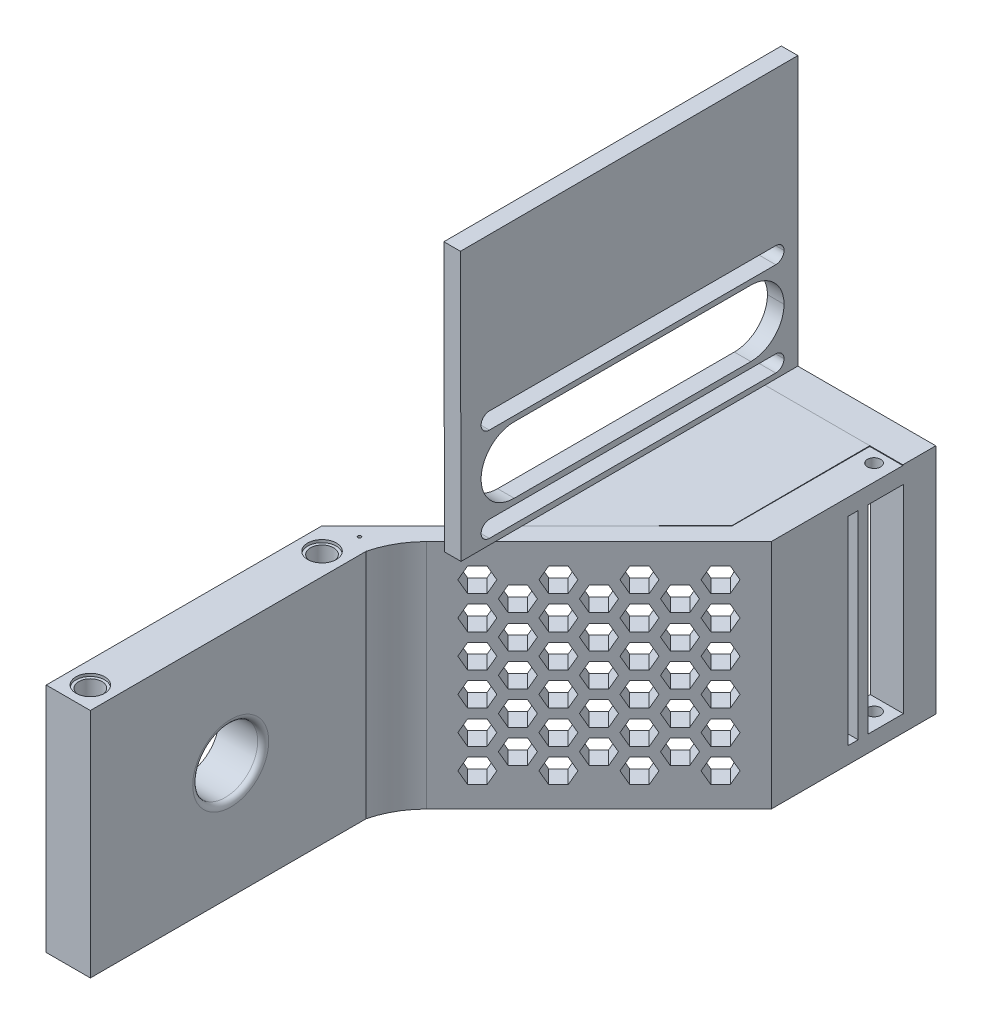
from build123d import *

# Parameters (mm, degrees)
SKETCH1_W            = 25
SKETCH1_H            = 50
SKETCH1_R            = 3.4
BOSS_EXTRUDE1_DEPTH  = 3
SKETCH2_W            = 50
SKETCH2_H            = 3
BOSS_EXTRUDE2_DEPTH  = 8
SKETCH3_W            = 8
SKETCH3_H            = 50
BOSS_EXTRUDE3_DEPTH  = 42
SKETCH4_R            = 2.65
CUT_EXTRUDE1_DEPTH   = 0.5
SKETCH5_R            = 5.888972746
CUT_EXTRUDE2_DEPTH   = 9
FILLET2_R            = 1
SKETCH6_R            = 12.6
BOSS_EXTRUDE4_DEPTH  = 2
FILLET4_R            = 1
SKETCH8_R            = 1.589780168
SKETCH8_R_2          = 1.777428262
CUT_EXTRUDE3_DEPTH   = 10
SKETCH9_W            = 49.021678163
SKETCH9_H            = 20.976854622
CUT_EXTRUDE4_DEPTH   = 68.79439129
SKETCH11_R           = 2.1
CUT_EXTRUDE5_DEPTH   = 59.480168703
SKETCH14_R           = 2.6
CUT_EXTRUDE6_DEPTH   = 0.5
BOSS_EXTRUDE5_DEPTH  = 42
FILLET5_R            = 15
BOSS_EXTRUDE6_DEPTH  = 42
SKETCH17_W           = 55.081474993
SKETCH17_H           = 48.753311723
BOSS_EXTRUDE7_DEPTH  = 3
BOSS_EXTRUDE8_DEPTH  = 2
FILL_START           = -39.593416363
FILL_PATTERN1_DEPTH  = 4.479865946
SKETCH27_W           = 7.5
SKETCH27_H           = 36
CUT_EXTRUDE11_DEPTH  = 117.155303663
SKETCH28_R           = 1.2
CUT_EXTRUDE12_DEPTH  = 113.83644218
SKETCH29_W           = 6
SKETCH29_H           = 42
BOSS_EXTRUDE11_DEPTH = 5.87
CHAMFER1_SIZE        = 4
SKETCH30_R           = 0.3
CUT_EXTRUDE13_DEPTH  = 118.999595961
SKETCH31_W           = 1.8
SKETCH31_H           = 36
CUT_EXTRUDE14_DEPTH  = 10
BOSS_EXTRUDE13_REACH = 132.206
SKETCH33_W           = 28
SKETCH33_H           = 1.999994694
BOSS_EXTRUDE14_REACH = 126.717
SKETCH34_W           = 3
SKETCH34_H           = 48.753311723
SKETCH35_W           = 54.914706507
SKETCH35_H           = 12
CUT_EXTRUDE15_DEPTH  = 4
FILLET6_R            = 6
FILLET7_R            = 6
SKETCH36_W           = 54.914706507
SKETCH36_H           = 3
CUT_EXTRUDE16_DEPTH  = 4
FILLET8_R            = 1.5


# Read off the part's stored shape, not the designer's step: Fill Pattern1
# Some blends are built 0.0001 mm under size
with BuildPart() as part:
    # Sketch1 → Boss-Extrude1 (new body)
    with BuildSketch(Plane(origin=(0, 0, 0), x_dir=(1, 0, 0), z_dir=(0, 1, 0))):
        with Locations((2.276951673, 11.384758364)):
            Rectangle(SKETCH1_W, SKETCH1_H)
        with Locations(Location((1.276951673, 11.384758364, 0), (0, 0, 270))):
            Circle(SKETCH1_R, mode=Mode.SUBTRACT)
    extrude(amount=BOSS_EXTRUDE1_DEPTH)

    # Sketch2 → Boss-Extrude2 (add)
    with BuildSketch(Plane.ZY.offset(10.223048327)):
        with Locations((-11.384758364, 1.5)):
            Rectangle(SKETCH2_W, SKETCH2_H)
    extrude(amount=BOSS_EXTRUDE2_DEPTH)

    # Sketch3 → Boss-Extrude3 (add)
    with BuildSketch(Plane.XZ):
        with Locations((-14.223048327, -11.384758364)):
            Rectangle(SKETCH3_W, SKETCH3_H)
    extrude(amount=BOSS_EXTRUDE3_DEPTH)

    # Sketch4 → Cut-Extrude1 (cut)
    with BuildSketch(Plane(origin=(0, 3, 0), x_dir=(1, 0, 0), z_dir=(0, 1, 0))):
        with Locations(Location((-14.223048327, 32.384758364, 0), (0, 0, 270))):
            Circle(SKETCH4_R)
        with Locations(Location((-14.223048327, -9.615241636, 0), (0, 0, 270))):
            Circle(SKETCH4_R)
    cut_extrude1 = extrude(amount=-CUT_EXTRUDE1_DEPTH, mode=Mode.SUBTRACT)

    # Mirror1: Cut-Extrude1 across plane
    add(cut_extrude1.mirror(Plane.ZX.offset(-19.5)), mode=Mode.SUBTRACT)

    # Sketch5 → Cut-Extrude2 (cut)
    with BuildSketch(Plane.ZY.offset(18.223048327)):
        with Locations((-11.836279124, -21)):
            Circle(SKETCH5_R)
    extrude(amount=-CUT_EXTRUDE2_DEPTH, mode=Mode.SUBTRACT)

    # Fillet2
    fillet2_edges = [part.edges().sort_by_distance(p)[0] for p in [
        (-10.223048327, -21, -17.72525187),
    ]]
    fillet(fillet2_edges, radius=FILLET2_R)

    # Mirror2: Cut-Extrude1 across plane
    add(cut_extrude1.mirror(Plane.ZY.offset(1.723048327)), mode=Mode.SUBTRACT)

    # Sketch6 → Boss-Extrude4 (add)
    with BuildSketch(Plane(origin=(0, 3, 0), x_dir=(1, 0, 0), z_dir=(0, 1, 0))):
        with BuildLine():
            Line((14.776951673, 5.825082115), (14.776951673, 16.944434614))
            ThreePointArc((14.776951673, 16.944434614), (-13.323048327, 11.384758364), (14.776951673, 5.825082115))
        make_face()
        with Locations(Location((1.276951673, 11.384758364, 0), (0, 0, 270))):
            Circle(SKETCH6_R, mode=Mode.SUBTRACT)
    extrude(amount=BOSS_EXTRUDE4_DEPTH)

    # Fillet4
    # the kernel refuses this fillet: 1 mm, written as the material it takes off along each edge
    with BuildSketch(Plane(origin=(14.776951673, 5, -3.325082115), x_dir=(0, -1, 0), z_dir=(0, 0, -1))) as fillet4_piece_1:
        with BuildLine():
            CenterArc((FILLET4_R, FILLET4_R), FILLET4_R, 180, 90)
            Line((0, FILLET4_R), (0, 0))
            Line((0, 0), (FILLET4_R, 0))
        make_face()
    extrude(amount=16.119352499, mode=Mode.SUBTRACT)

    # Sketch8 → Cut-Extrude3 (cut)
    with BuildSketch(Plane(origin=(0, 3, 0), x_dir=(1, 0, 0), z_dir=(0, 1, 0))):
        with Locations(Location((1.276951673, 19.884758364, 0), (0, 0, 270))):
            Circle(SKETCH8_R)
        with Locations(Location((1.276951673, 2.884758364, 0), (0, 0, 270))):
            Circle(SKETCH8_R_2)
    extrude(amount=-CUT_EXTRUDE3_DEPTH, mode=Mode.SUBTRACT)

    # Sketch9 → Cut-Extrude4 (cut, through all)
    with BuildSketch(Plane.XY.offset(13.615241636)):
        with Locations((-9.733887409, 10.488427311)):
            Rectangle(SKETCH9_W, SKETCH9_H)
    extrude(amount=-CUT_EXTRUDE4_DEPTH, mode=Mode.SUBTRACT)

    # Sketch11 → Cut-Extrude5 (cut, through all)
    with BuildSketch(Plane(origin=(0, 0, 0), x_dir=(1, 0, 0), z_dir=(0, 1, 0))):
        with Locations(Location((-14.223048327, 32.384758364, 0), (0, 0, 270))):
            Circle(SKETCH11_R)
    cut_extrude5 = extrude(amount=-CUT_EXTRUDE5_DEPTH, mode=Mode.SUBTRACT)

    # Mirror3: Cut-Extrude5 across plane
    add(cut_extrude5.mirror(Plane.XY.offset(-11.384758364)), mode=Mode.SUBTRACT)

    # Sketch14 → Cut-Extrude6 (cut)
    with BuildSketch(Plane(origin=(0, 0, 0), x_dir=(1, 0, 0), z_dir=(0, 1, 0))):
        with Locations(Location((-14.223048327, -9.615241636, 0), (0, 0, 270))):
            Circle(SKETCH14_R)
    cut_extrude6 = extrude(amount=-CUT_EXTRUDE6_DEPTH, mode=Mode.SUBTRACT)

    # Mirror4: Cut-Extrude6 across plane
    add(cut_extrude6.mirror(Plane.XY.offset(-11.384758364)), mode=Mode.SUBTRACT)

    # Sketch15 → Boss-Extrude5 (add)
    with BuildSketch(Plane(origin=(0, 0, 0), x_dir=(1, 0, 0), z_dir=(0, 1, 0))):
        Polygon((-18.223048327, 36.384758364), (24.976951673, 79.584758364), (24.976951673, 74.635010896), (-13.273300859, 36.384758364), align=None)
    extrude(amount=-BOSS_EXTRUDE5_DEPTH)

    # Fillet5
    # the kernel refuses this fillet: 15 mm, written as the material it adds along each edge
    with BuildSketch(Plane(origin=(-13.273300859, 0, -36.384758364), x_dir=(1, 0, 0), z_dir=(0, -1, 0))) as fillet5_piece_1:
        with BuildLine():
            CenterArc((17.611399837, 3.601803599), FILLET5_R, 193.893637127, 31.106362873)
            Line((7.004798119, -7.004798119), (0, 0))
            Line((0, 0), (3.050252532, 0))
        make_face()
    extrude(amount=42)

    # Sketch16 → Boss-Extrude6 (add)
    with BuildSketch(Plane(origin=(0, 0, 0), x_dir=(1, 0, 0), z_dir=(0, 1, 0))):
        Polygon((18.976951673, 73.584758364), (18.976951673, 98.584758364), (24.976951673, 98.584758364), (24.976951673, 79.584758364), align=None)
    extrude(amount=-BOSS_EXTRUDE6_DEPTH)



with BuildPart() as body_2:
    # Sketch17 → Boss-Extrude7 (new body)
    with BuildSketch(Plane(origin=(-0.023048327, -88.270826713, 236.630045038), x_dir=(0, 0.002303401717977271, -0.999997347166744), z_dir=(1, 0, 0))):
        with Locations((307.762919346, 112.002250776)):
            Rectangle(SKETCH17_W, SKETCH17_H)
    extrude(amount=-BOSS_EXTRUDE7_DEPTH)


with BuildPart() as part_1:
    add(part.part)

    add(body_2.part)  # Boss-Extrude8 merges body 2
    # Sketch18 → Boss-Extrude8 (add)
    with BuildSketch(Plane(origin=(0, -0.099943314, -0.00023021), x_dir=(1, 0, 0), z_dir=(0, -0.9999973471667442, -0.0023034017179773937))):
        Polygon((-3.023048327, -98.470916371), (-3.023048327, -51.487878646), (18.976951673, -73.487820284), (18.976951673, -98.487753963), (-3.023048327, -98.487753963), align=None)
    extrude(amount=BOSS_EXTRUDE8_DEPTH)

    # Fill Pattern1 outline → Fill Pattern1 (cut)
    with BuildSketch(Plane(origin=(0, 0, 0), x_dir=(0.7071067811865457, 0, -0.7071067811865495), z_dir=(0.7071067811865493, 0, 0.7071067811865458)).offset(FILL_START)):
        Polygon((30.253964255, -6), (31.503964255, -8.165063509), (34.003964255, -8.165063509), (35.253964255, -6), (34.003964255, -3.834936491), (31.503964255, -3.834936491), align=None)
        Polygon((45.842421523, -33), (47.092421523, -35.165063509), (49.592421523, -35.165063509), (50.842421523, -33), (49.592421523, -30.834936491), (47.092421523, -30.834936491), align=None)
        Polygon((40.6462691, -24), (41.8962691, -26.165063509), (44.3962691, -26.165063509), (45.6462691, -24), (44.3962691, -21.834936491), (41.8962691, -21.834936491), align=None)
        Polygon((35.450116678, -15), (36.700116678, -17.165063509), (39.200116678, -17.165063509), (40.450116678, -15), (39.200116678, -12.834936491), (36.700116678, -12.834936491), align=None)
        Polygon((52.288573946, -8.165063509), (54.788573946, -8.165063509), (56.038573946, -6), (54.788573946, -3.834936491), (52.288573946, -3.834936491), (51.038573946, -6), align=None)
        Polygon((41.8962691, -8.165063509), (44.3962691, -8.165063509), (45.6462691, -6), (44.3962691, -3.834936491), (41.8962691, -3.834936491), (40.6462691, -6), align=None)
        Polygon((62.680878791, -8.165063509), (65.180878791, -8.165063509), (66.430878791, -6), (65.180878791, -3.834936491), (62.680878791, -3.834936491), (61.430878791, -6), align=None)
        Polygon((30.253964255, -24), (31.503964255, -26.165063509), (34.003964255, -26.165063509), (35.253964255, -24), (34.003964255, -21.834936491), (31.503964255, -21.834936491), align=None)
        Polygon((35.450116678, -33), (36.700116678, -35.165063509), (39.200116678, -35.165063509), (40.450116678, -33), (39.200116678, -30.834936491), (36.700116678, -30.834936491), align=None)
        Polygon((62.680878791, -26.165063509), (65.180878791, -26.165063509), (66.430878791, -24), (65.180878791, -21.834936491), (62.680878791, -21.834936491), (61.430878791, -24), align=None)
        Polygon((52.288573946, -26.165063509), (54.788573946, -26.165063509), (56.038573946, -24), (54.788573946, -21.834936491), (52.288573946, -21.834936491), (51.038573946, -24), align=None)
        Polygon((57.484726369, -35.165063509), (59.984726369, -35.165063509), (61.234726369, -33), (59.984726369, -30.834936491), (57.484726369, -30.834936491), (56.234726369, -33), align=None)
        Polygon((49.592421523, -17.165063509), (50.842421523, -15), (49.592421523, -12.834936491), (47.092421523, -12.834936491), (45.842421523, -15), (47.092421523, -17.165063509), align=None)
        Polygon((35.450116678, -27), (36.700116678, -29.165063509), (39.200116678, -29.165063509), (40.450116678, -27), (39.200116678, -24.834936491), (36.700116678, -24.834936491), align=None)
        Polygon((30.253964255, -18), (31.503964255, -20.165063509), (34.003964255, -20.165063509), (35.253964255, -18), (34.003964255, -15.834936491), (31.503964255, -15.834936491), align=None)
        Polygon((40.6462691, -36), (41.8962691, -38.165063509), (44.3962691, -38.165063509), (45.6462691, -36), (44.3962691, -33.834936491), (41.8962691, -33.834936491), align=None)
        Polygon((57.484726369, -29.165063509), (59.984726369, -29.165063509), (61.234726369, -27), (59.984726369, -24.834936491), (57.484726369, -24.834936491), (56.234726369, -27), align=None)
        Polygon((47.092421523, -29.165063509), (49.592421523, -29.165063509), (50.842421523, -27), (49.592421523, -24.834936491), (47.092421523, -24.834936491), (45.842421523, -27), align=None)
        Polygon((34.003964255, -38.165063509), (35.253964255, -36), (34.003964255, -33.834936491), (31.503964255, -33.834936491), (30.253964255, -36), (31.503964255, -38.165063509), align=None)
        Polygon((49.592421523, -11.165063509), (50.842421523, -9), (49.592421523, -6.834936491), (47.092421523, -6.834936491), (45.842421523, -9), (47.092421523, -11.165063509), align=None)
        Polygon((44.3962691, -20.165063509), (45.6462691, -18), (44.3962691, -15.834936491), (41.8962691, -15.834936491), (40.6462691, -18), (41.8962691, -20.165063509), align=None)
        Polygon((35.450116678, -21), (36.700116678, -23.165063509), (39.200116678, -23.165063509), (40.450116678, -21), (39.200116678, -18.834936491), (36.700116678, -18.834936491), align=None)
        Polygon((30.253964255, -12), (31.503964255, -14.165063509), (34.003964255, -14.165063509), (35.253964255, -12), (34.003964255, -9.834936491), (31.503964255, -9.834936491), align=None)
        Polygon((40.6462691, -30), (41.8962691, -32.165063509), (44.3962691, -32.165063509), (45.6462691, -30), (44.3962691, -27.834936491), (41.8962691, -27.834936491), align=None)
        Polygon((57.484726369, -23.165063509), (59.984726369, -23.165063509), (61.234726369, -21), (59.984726369, -18.834936491), (57.484726369, -18.834936491), (56.234726369, -21), align=None)
        Polygon((47.092421523, -23.165063509), (49.592421523, -23.165063509), (50.842421523, -21), (49.592421523, -18.834936491), (47.092421523, -18.834936491), (45.842421523, -21), align=None)
        Polygon((34.003964255, -32.165063509), (35.253964255, -30), (34.003964255, -27.834936491), (31.503964255, -27.834936491), (30.253964255, -30), (31.503964255, -32.165063509), align=None)
        Polygon((44.3962691, -14.165063509), (45.6462691, -12), (44.3962691, -9.834936491), (41.8962691, -9.834936491), (40.6462691, -12), (41.8962691, -14.165063509), align=None)
        Polygon((62.680878791, -32.165063509), (65.180878791, -32.165063509), (66.430878791, -30), (65.180878791, -27.834936491), (62.680878791, -27.834936491), (61.430878791, -30), align=None)
        Polygon((52.288573946, -32.165063509), (54.788573946, -32.165063509), (56.038573946, -30), (54.788573946, -27.834936491), (52.288573946, -27.834936491), (51.038573946, -30), align=None)
        Polygon((62.680878791, -38.165063509), (65.180878791, -38.165063509), (66.430878791, -36), (65.180878791, -33.834936491), (62.680878791, -33.834936491), (61.430878791, -36), align=None)
        Polygon((52.288573946, -38.165063509), (54.788573946, -38.165063509), (56.038573946, -36), (54.788573946, -33.834936491), (52.288573946, -33.834936491), (51.038573946, -36), align=None)
        Polygon((56.234726369, -15), (57.484726369, -17.165063509), (59.984726369, -17.165063509), (61.234726369, -15), (59.984726369, -12.834936491), (57.484726369, -12.834936491), align=None)
        Polygon((56.234726369, -9), (57.484726369, -11.165063509), (59.984726369, -11.165063509), (61.234726369, -9), (59.984726369, -6.834936491), (57.484726369, -6.834936491), align=None)
        Polygon((61.430878791, -18), (62.680878791, -20.165063509), (65.180878791, -20.165063509), (66.430878791, -18), (65.180878791, -15.834936491), (62.680878791, -15.834936491), align=None)
        Polygon((36.700116678, -11.165063509), (39.200116678, -11.165063509), (40.450116678, -9), (39.200116678, -6.834936491), (36.700116678, -6.834936491), (35.450116678, -9), align=None)
        Polygon((54.788573946, -20.165063509), (56.038573946, -18), (54.788573946, -15.834936491), (52.288573946, -15.834936491), (51.038573946, -18), (52.288573946, -20.165063509), align=None)
        Polygon((62.680878791, -14.165063509), (65.180878791, -14.165063509), (66.430878791, -12), (65.180878791, -9.834936491), (62.680878791, -9.834936491), (61.430878791, -12), align=None)
        Polygon((52.288573946, -14.165063509), (54.788573946, -14.165063509), (56.038573946, -12), (54.788573946, -9.834936491), (52.288573946, -9.834936491), (51.038573946, -12), align=None)
    extrude(amount=FILL_PATTERN1_DEPTH, mode=Mode.SUBTRACT)

    # Sketch27 → Cut-Extrude11 (cut, through all)
    with BuildSketch(Plane.ZY.offset(-18.976951673)):
        with Locations((-97.706609658, -21)):
            Rectangle(SKETCH27_W, SKETCH27_H)
    extrude(amount=-CUT_EXTRUDE11_DEPTH, mode=Mode.SUBTRACT)

    # Sketch28 → Cut-Extrude12 (cut, through all)
    with BuildSketch(Plane(origin=(0, 0, 0), x_dir=(1, 0, 0), z_dir=(0, 1, 0))):
        with Locations(Location((21.976951673, 96.270684011, 0), (0, 0, 270))):
            Circle(SKETCH28_R)
    extrude(amount=-CUT_EXTRUDE12_DEPTH, mode=Mode.SUBTRACT)

    # Sketch29 → Boss-Extrude11 (add)
    with BuildSketch(Plane(origin=(0, 0, -98.584758364), x_dir=(-1, 0, 0), z_dir=(0, 0, -1))):
        with Locations((-21.976951673, -21)):
            Rectangle(SKETCH29_W, SKETCH29_H)
    extrude(amount=BOSS_EXTRUDE11_DEPTH)

    # Chamfer1
    chamfer1_edges = [part_1.edges().sort_by_distance(p)[0] for p in [
        (18.976951673, -21, -104.454758364),
    ]]
    chamfer(chamfer1_edges, length=CHAMFER1_SIZE)

    # Sketch30 → Cut-Extrude13 (cut, through all)
    with BuildSketch(Plane(origin=(0, 0, 0), x_dir=(1, 0, 0), z_dir=(0, 1, 0))):
        with Locations(Location((-13.114758504, 38.068023801, 0), (0, 0, 270))):
            Circle(SKETCH30_R)
    extrude(amount=-CUT_EXTRUDE13_DEPTH, mode=Mode.SUBTRACT)

    # Sketch31 → Cut-Extrude14 (cut)
    with BuildSketch(Plane(origin=(24.976951673, 0, 0), x_dir=(0, 0, -1), z_dir=(1, 0, 0))):
        with Locations((93.056609658, -21)):
            Rectangle(SKETCH31_W, SKETCH31_H)
        with Locations((89.484758364, -21)):
            Rectangle(SKETCH31_W, SKETCH31_H)
    extrude(amount=-CUT_EXTRUDE14_DEPTH, mode=Mode.SUBTRACT)

    # Boss-Extrude13: up to this plane
    boss_extrude13_end = Plane(origin=(18.976951673, -1.873081146, -98.492329705), z_dir=(0, -0.0023034017179773933, 0.999997347166744))
    # Sketch33 → Boss-Extrude13 (add, up to the surface)
    with BuildSketch(Plane(origin=(0, 0, -104.454758364), x_dir=(-1, 0, 0), z_dir=(0, 0, -1)), mode=Mode.PRIVATE) as boss_extrude13_sk1:
        with Locations((-10.976951673, -0.873083799)):
            Rectangle(SKETCH33_W, SKETCH33_H)
    boss_extrude13_tool1 = split(extrude(boss_extrude13_sk1.sketch, amount=-BOSS_EXTRUDE13_REACH, mode=Mode.PRIVATE), bisect_by=boss_extrude13_end, keep=Keep.BOTH, mode=Mode.PRIVATE)
    add(boss_extrude13_tool1.solids().sort_by_distance((10.976952, -0.873084, -104.454758))[0])

    # Boss-Extrude14: up to this plane
    boss_extrude14_end = Plane(origin=(0, 0, -104.454758364), z_dir=(0, 0, -1))
    # Sketch34 → Boss-Extrude14 (add, up to the surface)
    with BuildSketch(Plane(origin=(0, 0.226818078, -98.470655144), x_dir=(-1, 0, 0), z_dir=(0, 0.0023034017179766083, -0.9999973471667442)), mode=Mode.PRIVATE) as boss_extrude14_sk1:
        with Locations((1.523048327, 24.276712283)):
            Rectangle(SKETCH34_W, SKETCH34_H)
    boss_extrude14_tool1 = split(extrude(boss_extrude14_sk1.sketch, amount=BOSS_EXTRUDE14_REACH, mode=Mode.PRIVATE), bisect_by=boss_extrude14_end, keep=Keep.BOTH, mode=Mode.PRIVATE)
    add(boss_extrude14_tool1.solids().sort_by_distance((-1.523048, 24.503466, -98.414736))[0])

    # Sketch35 → Cut-Extrude15 (cut)
    with BuildSketch(Plane(origin=(-0.023048327, 0, 0), x_dir=(0, 0, -1), z_dir=(1, 0, 0))):
        with Locations((74.482029664, 11.107137395)):
            Rectangle(SKETCH35_W, SKETCH35_H)
    extrude(amount=-CUT_EXTRUDE15_DEPTH, mode=Mode.SUBTRACT)

    # Fillet6
    fillet6_edges = [part_1.edges().sort_by_distance(p)[0] for p in [
        (-1.523048327, 17.107137395, -101.939382917),
        (-1.523048327, 5.107137395, -101.939382917),
    ]]
    fillet(fillet6_edges, radius=FILLET6_R - 0.0001)  # a hair under: the kernel refuses the full size

    # Fillet7
    fillet7_edges = [part_1.edges().sort_by_distance(p)[0] for p in [
        (-1.523048327, 17.107137395, -47.02467641),
        (-1.523048327, 5.107137395, -47.02467641),
    ]]
    fillet(fillet7_edges, radius=FILLET7_R - 0.0001)  # a hair under: the kernel refuses the full size

    # Sketch36 → Cut-Extrude16 (cut)
    with BuildSketch(Plane(origin=(-0.023048327, 0, 0), x_dir=(0, 0, -1), z_dir=(1, 0, 0))):
        with Locations((74.482029664, 19.55874341)):
            Rectangle(SKETCH36_W, SKETCH36_H)
        with Locations((74.482029664, 2.558788508)):
            Rectangle(SKETCH36_W, SKETCH36_H)
    extrude(amount=-CUT_EXTRUDE16_DEPTH, mode=Mode.SUBTRACT)

    # Fillet8
    fillet8_edges = [part_1.edges().sort_by_distance(p)[0] for p in [
        (-1.523048327, 4.058788508, -47.02467641),
        (-1.523048327, 21.05874341, -47.02467641),
        (-1.523048327, 18.05874341, -47.02467641),
        (-1.523048327, 1.058788508, -47.02467641),
        (-1.523048327, 21.05874341, -101.939382917),
        (-1.523048327, 4.058788508, -101.939382917),
        (-1.523048327, 18.05874341, -101.939382917),
        (-1.523048327, 1.058788508, -101.939382917),
    ]]
    fillet(fillet8_edges, radius=FILLET8_R - 0.0001)  # a hair under: the kernel refuses the full size


solid = part_1.part
